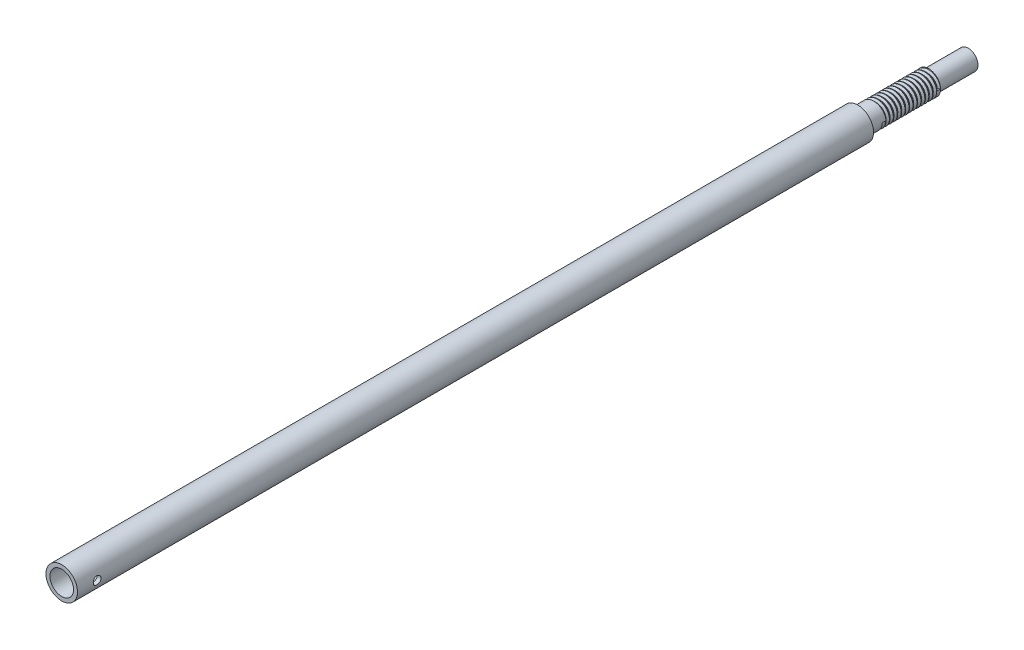
from build123d import *

# Parameters (mm, degrees)
SKETCH1_R               = 4
BOSS_EXTRUDE1_DEPTH     = 230
SKETCH2_R               = 3
CUT_EXTRUDE1_DEPTH      = 10
CHAMFER3_SIZE           = 0.5
CUT_EXTRUDE3_DEPTH      = 10
CUT_EXTRUDE3_DEPTH_BACK = 10
SKETCH8_R               = 1
SKETCH9_R               = 4
SKETCH9_R_2             = 3
CUT_EXTRUDE4_DEPTH      = 203.079192501
CHAMFER4_SIZE           = 0.5
CUT_EXTRUDE5_START      = -10
SKETCH11_R              = 3
SKETCH11_R_2            = 2.5
CUT_EXTRUDE5_DEPTH      = 10
THREAD1_PITCH           = 1


with BuildPart() as part:
    # Sketch1 → Boss-Extrude1 (new body)
    with BuildSketch(Plane.XY):
        Circle(SKETCH1_R)
    extrude(amount=BOSS_EXTRUDE1_DEPTH)

    # Sketch2 → Cut-Extrude1 (cut)
    with BuildSketch(Plane.XY.offset(230)):
        Circle(SKETCH2_R)
    extrude(amount=-CUT_EXTRUDE1_DEPTH, mode=Mode.SUBTRACT)

    # Chamfer3
    chamfer3_edges = [part.edges().sort_by_distance(p)[0] for p in [
        (-4, 0, 0),
    ]]
    chamfer(chamfer3_edges, length=CHAMFER3_SIZE)

    # Sketch8 → Cut-Extrude3 (cut, two sides: drawn at the far end of the back side and taken through both)
    with BuildSketch(Plane(origin=(0, 0, 0), x_dir=(0, 0, -1), z_dir=(1, 0, 0)).offset(-CUT_EXTRUDE3_DEPTH_BACK)):
        with Locations(Location((-225, 0, 0), (0, 0, 180))):
            Circle(SKETCH8_R)
    extrude(amount=CUT_EXTRUDE3_DEPTH + CUT_EXTRUDE3_DEPTH_BACK, mode=Mode.SUBTRACT)

    # Sketch9 → Cut-Extrude4 (cut, through all)
    with BuildSketch(Plane.XY.offset(28)):
        Circle(SKETCH9_R)
        Circle(SKETCH9_R_2, mode=Mode.SUBTRACT)
    extrude(amount=-CUT_EXTRUDE4_DEPTH, mode=Mode.SUBTRACT)

    # Chamfer4
    chamfer4_edges = [part.edges().sort_by_distance(p)[0] for p in [
        (-3, 0, 0),
    ]]
    chamfer(chamfer4_edges, length=CHAMFER4_SIZE)

    # Sketch11 → Cut-Extrude5 (cut)
    with BuildSketch(Plane(origin=(0, 0, 0), x_dir=(-1, 0, 0), z_dir=(0, 0, -1)).offset(CUT_EXTRUDE5_START)):
        with Locations(Location((0, 0, 0), (0, 0, 180))):
            Circle(SKETCH11_R)
        Circle(SKETCH11_R_2, mode=Mode.SUBTRACT)
    extrude(amount=CUT_EXTRUDE5_DEPTH, mode=Mode.SUBTRACT)

    # Thread1: the profile of Thread Profile1 profile screwed along a right-hand helix of 14 turns, 8 arcs to a turn; built about Z, then put on its axis
    thread1_z = Axis((0, 0, 0), (0, 0, 1))
    thread1_corners = [(3.0003, 0, -0.000173205), (3.0003, 0, 0.875173202), (2.458734125, 0, 0.562499999), (2.458734125, 0, 0.312499999)]
    with BuildLine(mode=Mode.PRIVATE) as thread1_profile:
        Line(thread1_corners[0], thread1_corners[1])
        Line(thread1_corners[1], thread1_corners[2])
        Line(thread1_corners[2], thread1_corners[3])
        Line(thread1_corners[3], thread1_corners[0])
    thread1_cap = Face(thread1_profile.wire())
    thread1_turn_angles = [0, 22.5, 45, 67.5, 90, 112.5, 135, 157.5, 180, 202.5, 225, 247.5, 270, 292.5, 315, 337.5, 360]
    thread1_turn_weights = [1, 0.9238795325112867, 1, 0.9238795325112867, 1, 0.9238795325112867, 1, 0.9238795325112867, 1, 0.9238795325112867, 1, 0.9238795325112867, 1, 0.9238795325112867, 1, 0.9238795325112867, 1]
    thread1_turn_rails = [Edge.make_bspline([Vector(p[0], p[1], 0).rotate(thread1_z, thread1_turn_angles[k]) / thread1_turn_weights[k] + Vector(0, 0, p[2] + THREAD1_PITCH * thread1_turn_angles[k] / 360) for k in range(17)], [0, 0, 0, 1, 1, 2, 2, 3, 3, 4, 4, 5, 5, 6, 6, 7, 7, 8, 8, 8], 2, thread1_turn_weights) for p in thread1_corners]
    thread1_turn_sides = [Face.make_surface_from_curves(thread1_turn_rails[p[0]], thread1_turn_rails[p[1]]) for p in [(0, 1), (1, 2), (2, 3), (3, 0)]]
    thread1 = Plane(origin=(0, 0, 10), x_dir=(1, 0, 0), z_dir=(0, 0, 1)) * Solid(Shell([*[p.moved(Location((0, 0, THREAD1_PITCH * i))) for i in range(14) for p in thread1_turn_sides], thread1_cap, thread1_cap.rotate(thread1_z, 5040).moved(Location((0, 0, THREAD1_PITCH * 5040 / 360)))]))
    add(thread1, mode=Mode.SUBTRACT)


solid = part.part
